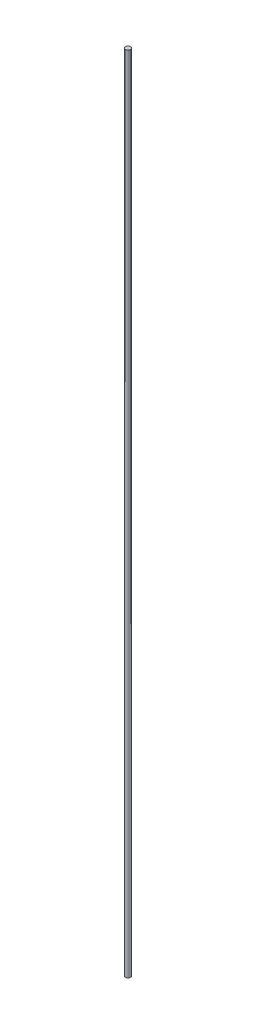
from build123d import *

# Parameters (mm, degrees)
SKETCH_2_W = 2.5
SKETCH_2_H = 803.4


with BuildPart() as part:
    # Эскиз2 → Повернуть1 (revolve)
    with BuildSketch(Plane.XY):
        with Locations((-1.25, -75.551481827)):
            Rectangle(SKETCH_2_W, SKETCH_2_H)
    revolve(axis=Axis((-2.5, 326.148518173, 0), (0, -1, 0)))


solid = part.part
